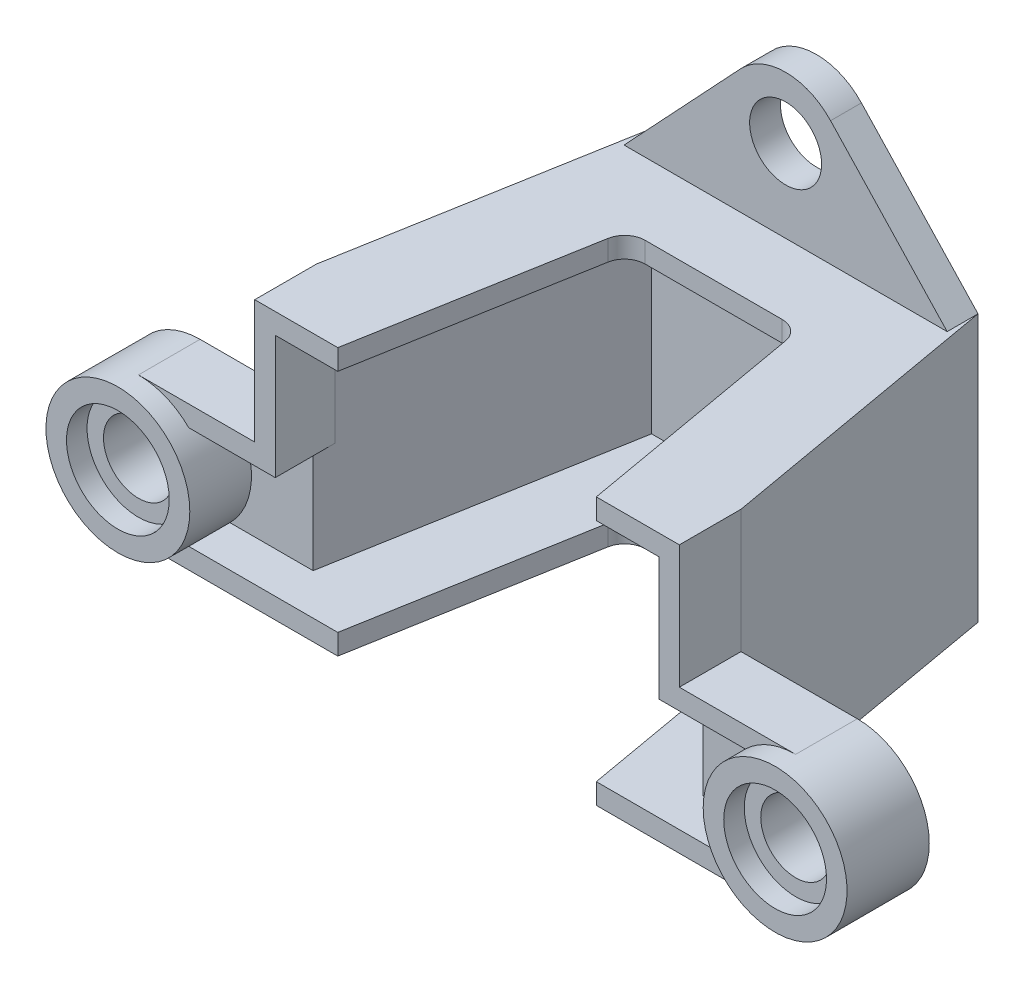
from build123d import *

# Parameters (mm, degrees)
ESTRUSIONE_ESTRUSIONE1_DEPTH = 3
SCHIZZO2_W                   = 20.66
SCHIZZO2_H                   = 13
ESTRUSIONE_ESTRUSIONE2_DEPTH = 14
TAGLIO_ESTRUSIONE1_DEPTH     = 25.91345219
SVUOTA1_T                    = -1
SCHIZZO4_R                   = 3.5
ESTRUSIONE_ESTRUSIONE3_DEPTH = 4
SCHIZZO5_R                   = 2.5
TAGLIO_ESTRUSIONE2_DEPTH     = 1
SCHIZZO6_R                   = 1.7
TAGLIO_ESTRUSIONE3_DEPTH     = 28.728326671
ESTRUSIONE_ESTRUSIONE4_DEPTH = 1.5
SCHIZZO8_R                   = 1.75
TAGLIO_ESTRUSIONE4_DEPTH     = 31.677517827
SCHIZZO9_R                   = 0.8
TAGLIO_ESTRUSIONE5_DEPTH     = 1.5
TAGLIO_ESTRUSIONE6_DEPTH     = 32.238759578
RACCORDO1_R                  = 1
SPECCHIA12_START             = 9
SPECCHIA12_DEPTH             = 1
RACCORDO2_R                  = 1
SPECCHIA15_START             = 9
SPECCHIA15_DEPTH             = 1
SCHIZZO12_R                  = 0.8
ESTRUSIONE_ESTRUSIONE5_DEPTH = 1.5
TAGLIO_ESTRUSIONE7_START     = -1
SCHIZZO13_R                  = 2.5
TAGLIO_ESTRUSIONE7_DEPTH     = 1


# Read off the part's stored shape, not the designer's step: Specchia12, Specchia15
with BuildPart() as part:
    # Schizzo1 → Estrusione-Estrusione1 (new body)
    with BuildSketch(Plane.XY):
        Polygon((-15.99, 4), (-10.33, 4), (-10.33, 10), (10.33, 10), (10.33, 4), (15.99, 4), (15.99, -3), (-15.99, -3), align=None)
    extrude(amount=ESTRUSIONE_ESTRUSIONE1_DEPTH)

    # Schizzo2 → Estrusione-Estrusione2 (add)
    with BuildSketch(Plane.XY):
        with Locations((0, 3.5)):
            Rectangle(SCHIZZO2_W, SCHIZZO2_H)
    extrude(amount=-ESTRUSIONE_ESTRUSIONE2_DEPTH)

    # Schizzo3 → Taglio-Estrusione1 (cut, through all)
    with BuildSketch(Plane(origin=(0, 10, 0), x_dir=(1, 0, 0), z_dir=(0, 1, 0))):
        Polygon((-10.33, 0), (-7.86142227, 14), (-10.33, 14), align=None)
    taglio_estrusione1 = extrude(amount=-TAGLIO_ESTRUSIONE1_DEPTH, mode=Mode.SUBTRACT)

    # Specchia1: Taglio-Estrusione1 across plane
    add(taglio_estrusione1.mirror(Plane(origin=(0, 0, 0), x_dir=(0, 0, 1), z_dir=(1, 0, 0))), mode=Mode.SUBTRACT)

    # Svuota1
    svuota1_openings = [part.faces().sort_by_distance(p)[0] for p in [
        (0, 2.81654304, 3),
    ]]
    offset(amount=SVUOTA1_T, openings=svuota1_openings, kind=Kind.INTERSECTION)

    # Schizzo4 → Estrusione-Estrusione3 (add)
    with BuildSketch(Plane.XY):
        with Locations(Location((-15.99, 0.5, 0), (0, 0, 270))):
            Circle(SCHIZZO4_R)
    estrusione_estrusione3 = extrude(amount=ESTRUSIONE_ESTRUSIONE3_DEPTH)

    # Schizzo5 → Taglio-Estrusione2 (cut)
    with BuildSketch(Plane.XY.offset(4)):
        with Locations((-15.99, 0.5)):
            Circle(SCHIZZO5_R)
    taglio_estrusione2 = extrude(amount=-TAGLIO_ESTRUSIONE2_DEPTH, mode=Mode.SUBTRACT)

    # Schizzo6 → Taglio-Estrusione3 (cut, through all)
    with BuildSketch(Plane.XY.offset(3)):
        with Locations((-15.99, 0.5)):
            Circle(SCHIZZO6_R)
    taglio_estrusione3 = extrude(amount=-TAGLIO_ESTRUSIONE3_DEPTH, mode=Mode.SUBTRACT)

    # Specchia2: Estrusione-Estrusione3, Taglio-Estrusione2, Taglio-Estrusione3 across plane
    add(estrusione_estrusione3.mirror(Plane(origin=(0, 0, 0), x_dir=(0, 0, 1), z_dir=(1, 0, 0))))
    add(taglio_estrusione2.mirror(Plane(origin=(0, 0, 0), x_dir=(0, 0, 1), z_dir=(1, 0, 0))), mode=Mode.SUBTRACT)
    add(taglio_estrusione3.mirror(Plane(origin=(0, 0, 0), x_dir=(0, 0, 1), z_dir=(1, 0, 0))), mode=Mode.SUBTRACT)

    # Schizzo7 → Estrusione-Estrusione4 (add)
    with BuildSketch(Plane(origin=(0, 0, -14), x_dir=(-1, 0, 0), z_dir=(0, 0, -1))):
        with BuildLine():
            Line((-7.86142227, 10), (-2.188751242, 16.051674439))
            ThreePointArc((-2.188751242, 16.051674439), (0, 17), (2.188751242, 16.051674439))
            Line((2.188751242, 16.051674439), (7.86142227, 10))
            Line((7.86142227, 10), (-7.86142227, 10))
        make_face()
    extrude(amount=-ESTRUSIONE_ESTRUSIONE4_DEPTH)

    # Schizzo8 → Taglio-Estrusione4 (cut, through all)
    with BuildSketch(Plane.XY.offset(-12.5)):
        with Locations((0, 14)):
            Circle(SCHIZZO8_R)
    extrude(amount=-TAGLIO_ESTRUSIONE4_DEPTH, mode=Mode.SUBTRACT)

    # Schizzo9 → Taglio-Estrusione5 (cut)
    with BuildSketch(Plane(origin=(0, 0, -14), x_dir=(-1, 0, 0), z_dir=(0, 0, -1))):
        with Locations((-5.36142227, 7.5)):
            Circle(SCHIZZO9_R)
    taglio_estrusione5 = extrude(amount=-TAGLIO_ESTRUSIONE5_DEPTH, mode=Mode.SUBTRACT)

    # Specchia5: Taglio-Estrusione5 across plane
    add(taglio_estrusione5.mirror(Plane(origin=(0, 0, 0), x_dir=(0, 0, 1), z_dir=(1, 0, 0))), mode=Mode.SUBTRACT)

    # Schizzo10 → Taglio-Estrusione6 (cut, through all)
    with BuildSketch(Plane.XZ.offset(3)):
        Polygon((-6.289561189, 3), (-4.17363742, -9), (4.17363742, -9), (6.289561189, 3), align=None)
    extrude(amount=-TAGLIO_ESTRUSIONE6_DEPTH, mode=Mode.SUBTRACT)

    # Raccordo1
    raccordo1_edges = [part.edges().sort_by_distance(p)[0] for p in [
        (-4.17363742, -2.5, -9),
    ]]
    fillet(raccordo1_edges, radius=RACCORDO1_R)

    # Specchia12 outline → Specchia12 (add)
    with BuildSketch(Plane(origin=(0, 0, 0), x_dir=(1, 0, 0), z_dir=(0, 1, 0)).offset(SPECCHIA12_START)):
        with BuildLine():
            ThreePointArc((-4.319345542, 8.173648178), (-3.977325399, 8.766044443), (-3.334537789, 9))
            Line((-3.334537789, 9), (-4.17363742, 9))
            Line((-4.17363742, 9), (-4.319345542, 8.173648178))
        make_face()
    extrude(amount=SPECCHIA12_DEPTH)

    # Raccordo2
    raccordo2_edges = [part.edges().sort_by_distance(p)[0] for p in [
        (4.17363742, -2.5, -9),
    ]]
    fillet(raccordo2_edges, radius=RACCORDO2_R)

    # Specchia15 outline → Specchia15 (add)
    with BuildSketch(Plane(origin=(0, 0, 0), x_dir=(1, 0, 0), z_dir=(0, 1, 0)).offset(SPECCHIA15_START)):
        with BuildLine():
            ThreePointArc((3.334537789, 9), (3.977325399, 8.766044443), (4.319345542, 8.173648178))
            Line((4.319345542, 8.173648178), (4.17363742, 9))
            Line((4.17363742, 9), (3.334537789, 9))
        make_face()
    extrude(amount=SPECCHIA15_DEPTH)

    # Schizzo12 → Estrusione-Estrusione5 (add)
    with BuildSketch(Plane(origin=(0, 0, -14), x_dir=(-1, 0, 0), z_dir=(0, 0, -1))):
        with BuildLine():
            Line((-7.86142227, -3), (-2.918334989, -8.273345625))
            ThreePointArc((-2.918334989, -8.273345625), (0, -9.537779706), (2.918334989, -8.273345625))
            Line((2.918334989, -8.273345625), (7.86142227, -3))
            Line((7.86142227, -3), (-7.86142227, -3))
        make_face()
        with Locations((0, -4.5)):
            Circle(SCHIZZO12_R, mode=Mode.SUBTRACT)
    extrude(amount=-ESTRUSIONE_ESTRUSIONE5_DEPTH)

    # Schizzo13 → Taglio-Estrusione7 (cut)
    with BuildSketch(Plane(origin=(0, 0, 0), x_dir=(-1, 0, 0), z_dir=(0, 0, -1)).offset(TAGLIO_ESTRUSIONE7_START)):
        with Locations((-15.99, 0.5)):
            Circle(SCHIZZO13_R)
    taglio_estrusione7 = extrude(amount=TAGLIO_ESTRUSIONE7_DEPTH, mode=Mode.SUBTRACT)

    # Specchia16: Taglio-Estrusione7 across plane
    add(taglio_estrusione7.mirror(Plane(origin=(0, 0, 0), x_dir=(0, 0, 1), z_dir=(1, 0, 0))), mode=Mode.SUBTRACT)


solid = part.part
